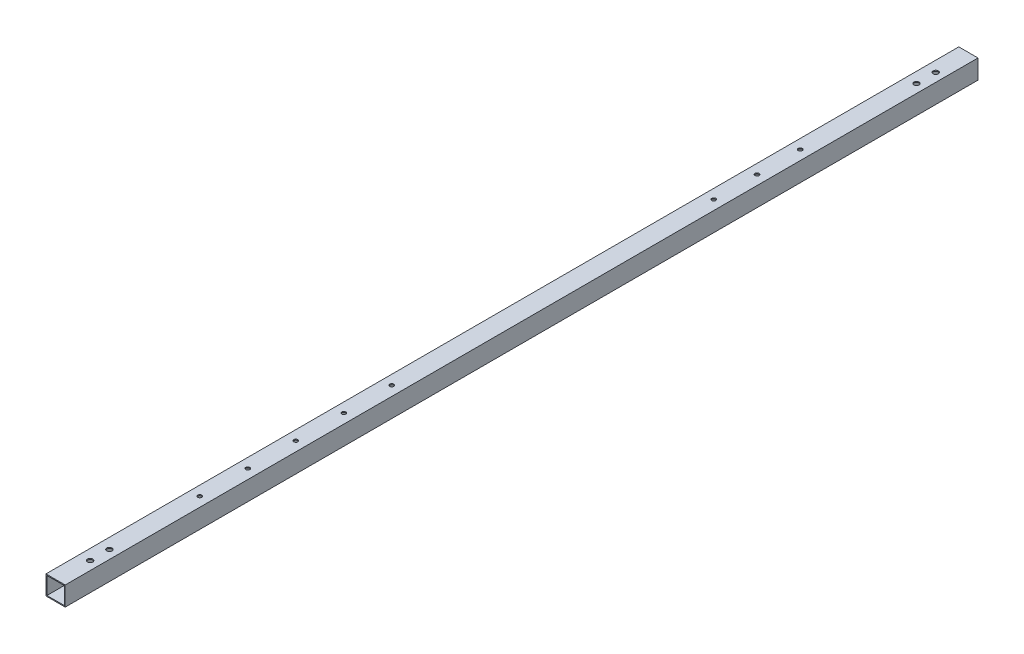
from build123d import *

# Parameters (mm, degrees)
SKETCH_1_W          = 20
SKETCH_1_H          = 20
SKETCH_1_W_2        = 18
SKETCH_1_H_2        = 18
EXTRUDE_1_DEPTH     = 950
SKETCH_2_R          = 2.75
CUT_EXTRUDE_1_DEPTH = 37
SKETCH_3_R          = 2.1
CUT_EXTRUDE_2_DEPTH = 37
SKETCH_4_R          = 2.1
CUT_EXTRUDE_3_DEPTH = 37


with BuildPart() as part:
    # 草图1 → 拉伸-薄壁1 (new body)
    with BuildSketch(Plane.XY):
        with Locations((10, -10)):
            Rectangle(SKETCH_1_W, SKETCH_1_H)
        with Locations((10, -10)):
            Rectangle(SKETCH_1_W_2, SKETCH_1_H_2, mode=Mode.SUBTRACT)
    extrude(amount=EXTRUDE_1_DEPTH)

    # 草图2 → 切除-拉伸1 (cut)
    with BuildSketch(Plane(origin=(0, 0, 0), x_dir=(1, 0, 0), z_dir=(0, 1, 0))):
        with Locations((11, -35)):
            Circle(SKETCH_2_R)
        with Locations((11, -55)):
            Circle(SKETCH_2_R)
        with Locations((11, -895)):
            Circle(SKETCH_2_R)
        with Locations((11, -915)):
            Circle(SKETCH_2_R)
    extrude(amount=-CUT_EXTRUDE_1_DEPTH, mode=Mode.SUBTRACT)

    # 草图3 → 切除-拉伸2 (cut)
    with BuildSketch(Plane(origin=(0, 0, 0), x_dir=(1, 0, 0), z_dir=(0, 1, 0))):
        with Locations((10, -175)):
            Circle(SKETCH_3_R)
        with Locations((10, -220)):
            Circle(SKETCH_3_R)
        with Locations((10, -265)):
            Circle(SKETCH_3_R)
    extrude(amount=-CUT_EXTRUDE_2_DEPTH, mode=Mode.SUBTRACT)

    # 草图4 → 切除-拉伸3 (cut)
    with BuildSketch(Plane(origin=(0, 0, 0), x_dir=(1, 0, 0), z_dir=(0, 1, 0))):
        with Locations((10, -800)):
            Circle(SKETCH_4_R)
        with Locations((10, -750)):
            Circle(SKETCH_4_R)
        with Locations((10, -700)):
            Circle(SKETCH_4_R)
        with Locations((10, -650)):
            Circle(SKETCH_4_R)
        with Locations((10, -600)):
            Circle(SKETCH_4_R)
    extrude(amount=-CUT_EXTRUDE_3_DEPTH, mode=Mode.SUBTRACT)


solid = part.part
